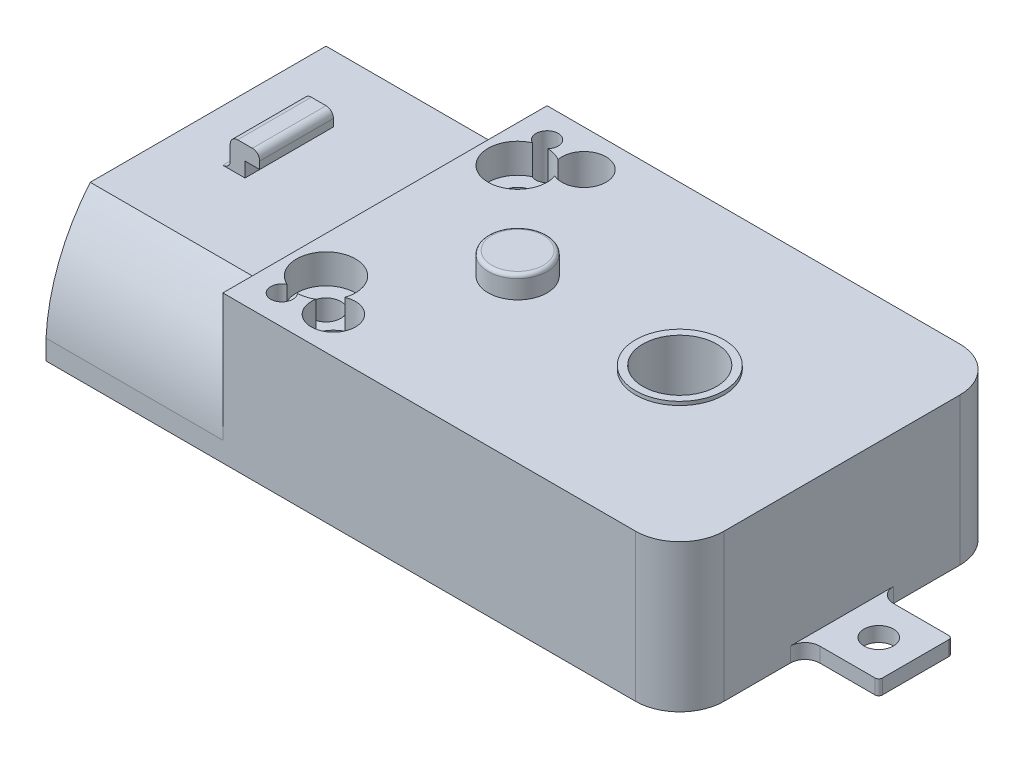
from build123d import *

# Parameters (mm, degrees)
SKETCH2_W               = 31
SKETCH2_H               = 22
BOSS_EXTRUDE2_DEPTH     = 9
SKETCH4_W               = 5
SKETCH4_H               = 1
BOSS_EXTRUDE3_DEPTH     = 5
SKETCH5_R               = 1
CUT_EXTRUDE1_DEPTH      = 5
FILLET1_R               = 1
FILLET2_R               = 1
FILLET3_R               = 3
FILLET4_R               = 3
BOSS_EXTRUDE4_DEPTH     = 12
FILLET6_R               = 0.25
CUT_EXTRUDE7_DEPTH      = 44.13930922
CUT_EXTRUDE7_DEPTH_BACK = 44.13930922
SKETCH10_R              = 1.5
SKETCH12_R              = 0.75
CUT_EXTRUDE8_DEPTH      = 3
SKETCH13_W              = 1
SKETCH13_H              = 5
BOSS_EXTRUDE5_DEPTH     = 2
SKETCH14_W              = 5
SKETCH14_H              = 1
BOSS_EXTRUDE6_DEPTH     = 1
FILLET7_R               = 0.5
FILLET8_R               = 0.5
FILLET9_R               = 0.5
CUT_EXTRUDE9_DEPTH      = 10
BOSS_EXTRUDE7_START     = 1
BOSS_EXTRUDE7_DEPTH     = 1
SKETCH18_R              = 1.5
CUT_EXTRUDE12_DEPTH     = 44.358966777
SKETCH19_R              = 0.75
CUT_EXTRUDE14_DEPTH     = 44.358966777
SKETCH20_R              = 2
BOSS_EXTRUDE8_DEPTH     = 1.5
FILLET10_R              = 0.25
SKETCH21_R              = 2.5
CUT_EXTRUDE15_DEPTH     = 5
BOSS_EXTRUDE9_START     = 0.25
SKETCH22_R              = 3
SKETCH22_R_2            = 2.5
BOSS_EXTRUDE9_DEPTH     = 0.25
SKETCH24_R              = 2
CUT_EXTRUDE16_DEPTH     = 2
SKETCH25_R              = 1
CUT_EXTRUDE17_DEPTH     = 5


with BuildPart() as part:
    # Sketch2 → Boss-Extrude2 (new body)
    with BuildSketch(Plane(origin=(0, 0, 0), x_dir=(1, 0, 0), z_dir=(0, 1, 0))):
        with Locations((15.5, 11)):
            Rectangle(SKETCH2_W, SKETCH2_H)
    extrude(amount=BOSS_EXTRUDE2_DEPTH)

    # Sketch4 → Boss-Extrude3 (add)
    with BuildSketch(Plane(origin=(31, 0, 0), x_dir=(0, 0, -1), z_dir=(1, 0, 0))):
        with Locations((11, 0.5)):
            Rectangle(SKETCH4_W, SKETCH4_H)
    extrude(amount=BOSS_EXTRUDE3_DEPTH)

    # Sketch5 → Cut-Extrude1 (cut)
    with BuildSketch(Plane(origin=(0, 1, 0), x_dir=(1, 0, 0), z_dir=(0, 1, 0))):
        with Locations((33.5, 11)):
            Circle(SKETCH5_R)
    extrude(amount=-CUT_EXTRUDE1_DEPTH, mode=Mode.SUBTRACT)

    # Fillet1
    fillet1_edges = [part.edges().sort_by_distance(p)[0] for p in [
        (31, 0.5, -8.5),
    ]]
    fillet(fillet1_edges, radius=FILLET1_R)

    # Fillet2
    fillet2_edges = [part.edges().sort_by_distance(p)[0] for p in [
        (31, 0.5, -13.5),
    ]]
    fillet(fillet2_edges, radius=FILLET2_R)

    # Fillet3
    fillet3_edges = [part.edges().sort_by_distance(p)[0] for p in [
        (31, 4.5, 0),
    ]]
    fillet(fillet3_edges, radius=FILLET3_R)

    # Fillet4
    fillet4_edges = [part.edges().sort_by_distance(p)[0] for p in [
        (31, 4.5, -22),
    ]]
    fillet(fillet4_edges, radius=FILLET4_R)

    # Sketch6 → Boss-Extrude4 (add)
    with BuildSketch(Plane.ZY):
        with BuildLine():
            Line((-22, 0), (0, 0))
            Line((0, 0), (0, 1.344936316))
            ThreePointArc((0, 1.344936316), (-0.878877088, 5.415884648), (-3, 9))
            Line((-3, 9), (-19, 9))
            ThreePointArc((-19, 9), (-21.121122912, 5.415884648), (-22, 1.344936316))
            Line((-22, 1.344936316), (-22, 0))
        make_face()
    extrude(amount=BOSS_EXTRUDE4_DEPTH)

    # Fillet6
    fillet6_edges = [part.edges().sort_by_distance(p)[0] for p in [
        (36, 0.5, -13.5),
        (36, 0.5, -8.5),
    ]]
    fillet(fillet6_edges, radius=FILLET6_R)

    # Sketch10 → Cut-Extrude7 (cut, two sides: drawn at the far end of the back side and taken through both)
    with BuildSketch(Plane(origin=(0, 9, 0), x_dir=(1, 0, 0), z_dir=(0, 1, 0)).offset(-CUT_EXTRUDE7_DEPTH_BACK)):
        with Locations((5, 19.5)):
            Circle(SKETCH10_R)
        with Locations((5, 2.5)):
            Circle(SKETCH10_R)
    extrude(amount=CUT_EXTRUDE7_DEPTH + CUT_EXTRUDE7_DEPTH_BACK, mode=Mode.SUBTRACT)

    # Sketch12 → Cut-Extrude8 (cut)
    with BuildSketch(Plane(origin=(0, 9, 0), x_dir=(1, 0, 0), z_dir=(0, 1, 0))):
        with Locations((2, 2)):
            Circle(SKETCH12_R)
        with Locations((2, 20)):
            Circle(SKETCH12_R)
    extrude(amount=-CUT_EXTRUDE8_DEPTH, mode=Mode.SUBTRACT)

    # Sketch13 → Boss-Extrude5 (add)
    with BuildSketch(Plane(origin=(0, 9, 0), x_dir=(1, 0, 0), z_dir=(0, 1, 0))):
        with Locations((-7.5, 11)):
            Rectangle(SKETCH13_W, SKETCH13_H)
    extrude(amount=BOSS_EXTRUDE5_DEPTH)

    # Sketch14 → Boss-Extrude6 (add)
    with BuildSketch(Plane(origin=(-7, 0, 0), x_dir=(0, 0, -1), z_dir=(1, 0, 0))):
        with Locations((11, 10.5)):
            Rectangle(SKETCH14_W, SKETCH14_H)
    extrude(amount=BOSS_EXTRUDE6_DEPTH)

    # Fillet7
    fillet7_edges = [part.edges().sort_by_distance(p)[0] for p in [
        (-8, 11, -11),
    ]]
    fillet(fillet7_edges, radius=FILLET7_R)

    # Fillet8
    fillet8_edges = [part.edges().sort_by_distance(p)[0] for p in [
        (-8, 9, -11),
    ]]
    fillet(fillet8_edges, radius=FILLET8_R)

    # Fillet9
    fillet9_edges = [part.edges().sort_by_distance(p)[0] for p in [
        (-6, 11, -11),
    ]]
    fillet(fillet9_edges, radius=FILLET9_R)

    # Sketch16 → Cut-Extrude9 (cut)
    with BuildSketch(Plane.ZY.offset(12)):
        with BuildLine():
            Line((-18.232108037, 8.359420628), (-3.767891963, 8.359420628))
            ThreePointArc((-3.767891963, 8.359420628), (-1.809932353, 5.051006457), (-0.998661194, 1.293207997))
            Line((-0.998661194, 1.293207997), (-0.998661194, 0))
            Line((-0.998661194, 0), (-21, 0))
            Line((-21, 0), (-21.001338806, 1.293207997))
            ThreePointArc((-21.001338806, 1.293207997), (-20.190067647, 5.051006457), (-18.232108037, 8.359420628))
        make_face()
    extrude(amount=-CUT_EXTRUDE9_DEPTH, mode=Mode.SUBTRACT)

    # Sketch17 → Boss-Extrude7 (add)
    with BuildSketch(Plane(origin=(0, 9, 0), x_dir=(1, 0, 0), z_dir=(0, 1, 0)).offset(BOSS_EXTRUDE7_START)):
        with BuildLine():
            Line((0, 3), (0, 19))
            Line((0, 19), (0, 22))
            Line((0, 22), (28, 22))
            ThreePointArc((28, 22), (30.121320344, 21.121320344), (31, 19))
            Line((31, 19), (31, 3))
            ThreePointArc((31, 3), (30.121320344, 0.878679656), (28, 0))
            Line((28, 0), (0, 0))
            Line((0, 0), (0, 3))
        make_face()
    extrude(amount=-BOSS_EXTRUDE7_DEPTH)

    # Sketch18 → Cut-Extrude12 (cut, through all)
    with BuildSketch(Plane(origin=(0, 10, 0), x_dir=(1, 0, 0), z_dir=(0, 1, 0))):
        with Locations((5, 19.5)):
            Circle(SKETCH18_R)
        with Locations((5, 2.5)):
            Circle(SKETCH18_R)
    extrude(amount=-CUT_EXTRUDE12_DEPTH, mode=Mode.SUBTRACT)

    # Sketch19 → Cut-Extrude14 (cut, through all)
    with BuildSketch(Plane(origin=(0, 10, 0), x_dir=(1, 0, 0), z_dir=(0, 1, 0))):
        with Locations((2, 20)):
            Circle(SKETCH19_R)
        with Locations((2, 2)):
            Circle(SKETCH19_R)
    extrude(amount=-CUT_EXTRUDE14_DEPTH, mode=Mode.SUBTRACT)

    # Sketch20 → Boss-Extrude8 (add)
    with BuildSketch(Plane(origin=(0, 10, 0), x_dir=(1, 0, 0), z_dir=(0, 1, 0))):
        with Locations((9, 11)):
            Circle(SKETCH20_R)
    extrude(amount=BOSS_EXTRUDE8_DEPTH)

    # Fillet10
    fillet10_edges = [part.edges().sort_by_distance(p)[0] for p in [
        (7, 11.5, -11),
    ]]
    fillet(fillet10_edges, radius=FILLET10_R)

    # Sketch21 → Cut-Extrude15 (cut)
    with BuildSketch(Plane(origin=(0, 10, 0), x_dir=(1, 0, 0), z_dir=(0, 1, 0))):
        with Locations((20, 11)):
            Circle(SKETCH21_R)
    extrude(amount=-CUT_EXTRUDE15_DEPTH, mode=Mode.SUBTRACT)

    # Sketch22 → Boss-Extrude9 (add)
    with BuildSketch(Plane(origin=(0, 10, 0), x_dir=(1, 0, 0), z_dir=(0, 1, 0)).offset(BOSS_EXTRUDE9_START)):
        with Locations((20, 11)):
            Circle(SKETCH22_R)
        with Locations((20, 11)):
            Circle(SKETCH22_R_2, mode=Mode.SUBTRACT)
    extrude(amount=-BOSS_EXTRUDE9_DEPTH)

    # Sketch24 → Cut-Extrude16 (cut)
    with BuildSketch(Plane(origin=(0, 10, 0), x_dir=(1, 0, 0), z_dir=(0, 1, 0))):
        with Locations((2.5, 17.5)):
            Circle(SKETCH24_R)
        with Locations((2.5, 4.5)):
            Circle(SKETCH24_R)
    extrude(amount=-CUT_EXTRUDE16_DEPTH, mode=Mode.SUBTRACT)

    # Sketch25 → Cut-Extrude17 (cut)
    with BuildSketch(Plane(origin=(0, 10, 0), x_dir=(1, 0, 0), z_dir=(0, 1, 0))):
        with Locations((2.5, 17.5)):
            Circle(SKETCH25_R)
        with Locations((2.5, 4.5)):
            Circle(SKETCH25_R)
    extrude(amount=-CUT_EXTRUDE17_DEPTH, mode=Mode.SUBTRACT)


solid = part.part
